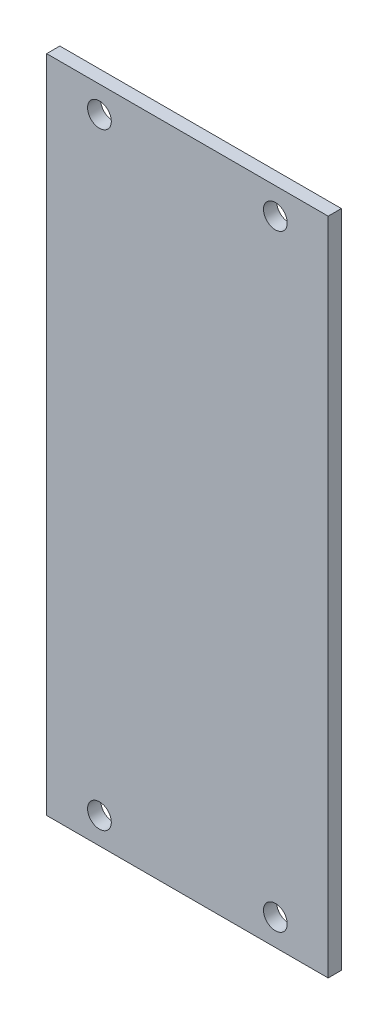
from build123d import *

# Parameters (mm, degrees)
SKETCH1_W           = 64
SKETCH1_H           = 150
SKETCH1_R           = 2.699339217
BOSS_EXTRUDE1_DEPTH = 3


with BuildPart() as part:
    # Sketch1 → Boss-Extrude1 (new body)
    with BuildSketch(Plane.XY):
        with Locations((26, -55)):
            Rectangle(SKETCH1_W, SKETCH1_H)
        with Locations((6, -124)):
            Circle(SKETCH1_R, mode=Mode.SUBTRACT)
        with Locations((46, -124)):
            Circle(SKETCH1_R, mode=Mode.SUBTRACT)
        with Locations((6, 14)):
            Circle(SKETCH1_R, mode=Mode.SUBTRACT)
        with Locations((46, 14)):
            Circle(SKETCH1_R, mode=Mode.SUBTRACT)
    extrude(amount=BOSS_EXTRUDE1_DEPTH)


solid = part.part
